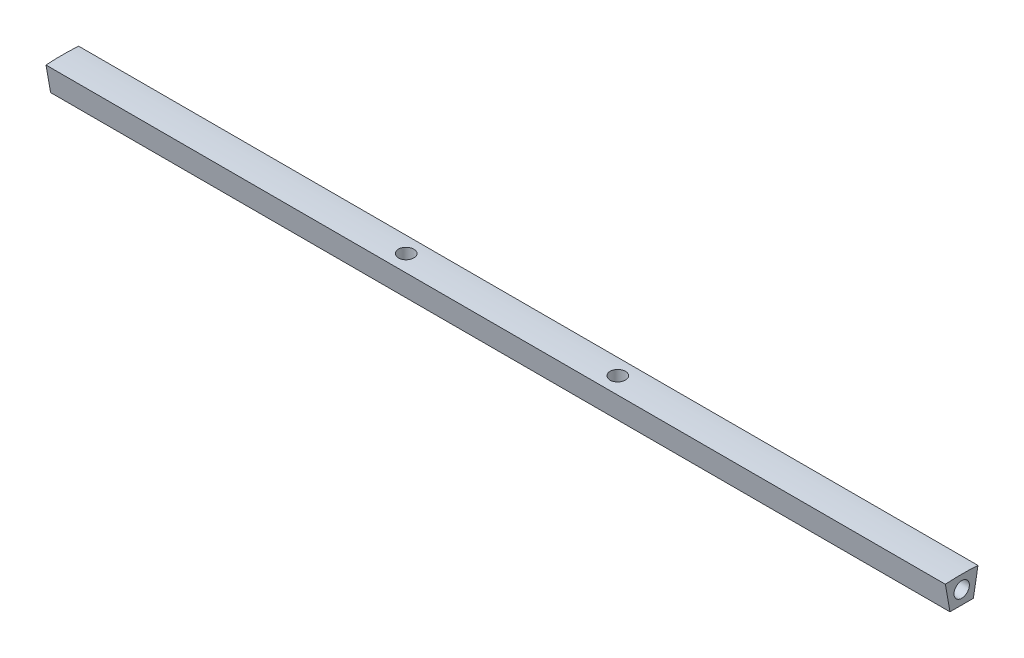
from build123d import *

# Parameters (mm, degrees)
EXTRUDE_1_DEPTH     = 85
SKETCH_2_R          = 1.45
CUT_EXTRUDE_1_DEPTH = 10
SKETCH_3_R          = 1.45
CUT_EXTRUDE_2_DEPTH = 10


with BuildPart() as part:
    # Эскиз1 → Бобышка-Вытянуть1 (new, symmetric)
    with BuildSketch(Plane(origin=(0, 0, 0), x_dir=(0, 0, -1), z_dir=(1, 0, 0))):
        with BuildLine():
            Line((-3.085485457, 17.498657575), (-2.211734297, 12.543368507))
            Line((-2.211734297, 12.543368507), (2.211734297, 12.543368507))
            Line((2.211734297, 12.543368507), (3.085485457, 17.498657575))
            ThreePointArc((3.085485457, 17.498657575), (0, 17.604562424), (-3.085485457, 17.498657575))
        make_face()
    extrude(amount=EXTRUDE_1_DEPTH, both=True)

    # Эскиз2 → Вырез-Вытянуть1 (cut)
    with BuildSketch(Plane(origin=(85, 0, 0), x_dir=(0, 0, -1), z_dir=(1, 0, 0))):
        with Locations((0, 15.104562424)):
            Circle(SKETCH_2_R)
    cut_extrude_1 = extrude(amount=-CUT_EXTRUDE_1_DEPTH, mode=Mode.SUBTRACT)

    # Зеркальное отражение1: Вырез-Вытянуть1 across plane
    add(cut_extrude_1.mirror(Plane(origin=(0, 0, 0), x_dir=(0, 0, 1), z_dir=(1, 0, 0))), mode=Mode.SUBTRACT)

    # Эскиз3 → Вырез-Вытянуть2 (cut)
    with BuildSketch(Plane.XZ.offset(-12.543368507)):
        with Locations((-20, 0)):
            Circle(SKETCH_3_R)
        with Locations((20, 0)):
            Circle(SKETCH_3_R)
    extrude(amount=-CUT_EXTRUDE_2_DEPTH, mode=Mode.SUBTRACT)


solid = part.part
